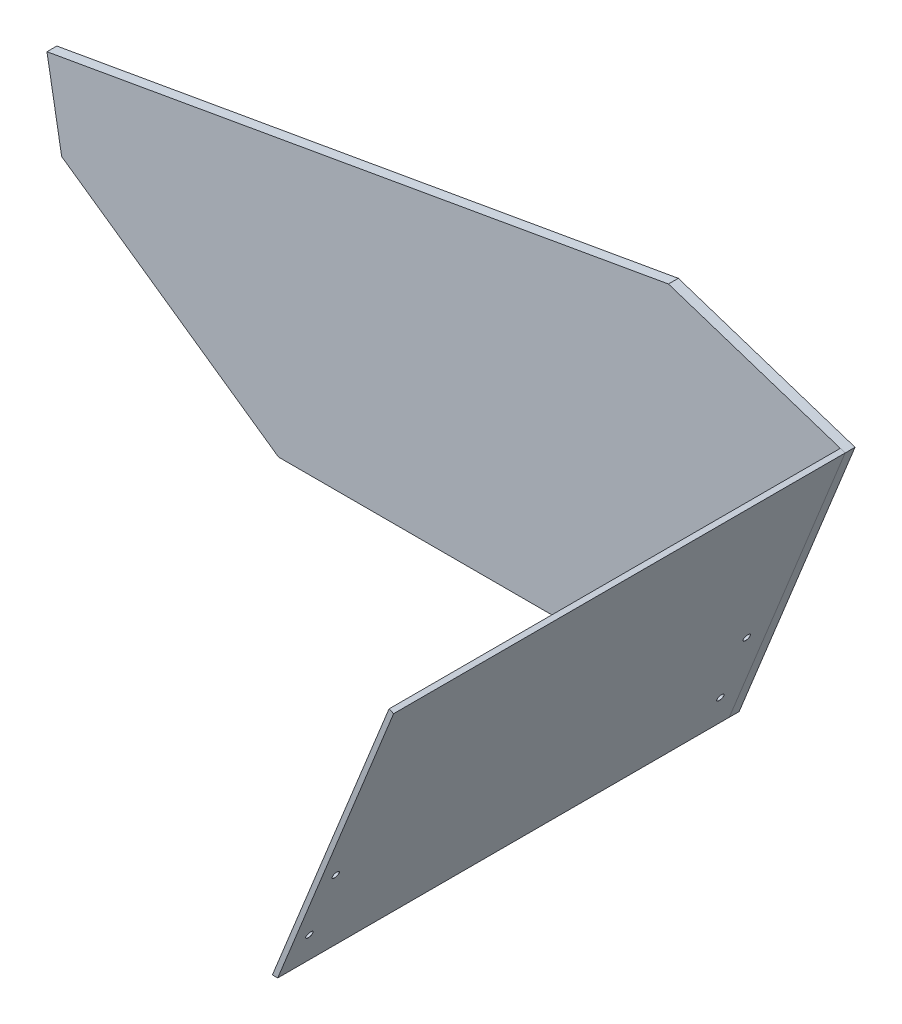
from build123d import *

# Parameters (mm, degrees)
BOSS_EXTRUDE1_DEPTH           = 290
BOSS_EXTRUDE2_DEPTH           = 6.35
M4_CLEARANCE_HOLE1_AT_2_COUNT = 2
M4_CLEARANCE_HOLE1_AT_2_PITCH = 45
M4_CLEARANCE_HOLE1_AT_3_COUNT = 2
M4_CLEARANCE_HOLE1_AT_3_PITCH = 264
M4_CLEARANCE_HOLE1_AT_4_COUNT = 2
M4_CLEARANCE_HOLE1_AT_4_PITCH = 267.807766878


with BuildPart() as part:
    # Sketch1 → Boss-Extrude1 (new body)
    with BuildSketch(Plane.XY):
        Polygon((140, 0), (143.424347808, 0), (217.865127421, 184.247394979), (214.921318683, 185.436770913), align=None)
    extrude(amount=BOSS_EXTRUDE1_DEPTH)

    # Sketch4 → M4 Clearance Hole1 (revolve, cut)
    with BuildSketch(Plane(origin=(169.646809347, 64.90286982, 279), x_dir=(0.3746065934159096, 0.9271838545667884, 0), z_dir=(0, 0, 1))):
        Polygon((0, 0), (0, 489.265093346), (2.25, 489.265093346), (2.25, 0.025), (2.275, 0), align=None)
    m4_clearance_hole1 = revolve(axis=Axis((175.534426824, 62.524117951, 279), (-0.9271838545667884, 0.37460659341590974, 0)), mode=Mode.SUBTRACT)

    # M4 Clearance Hole1 at 2: M4 Clearance Hole1 ×2
    with Locations(*[Vector(-0.3746065934159097, -0.9271838545667884, 0) * (i * M4_CLEARANCE_HOLE1_AT_2_PITCH) for i in range(1, M4_CLEARANCE_HOLE1_AT_2_COUNT)]):
        add(m4_clearance_hole1, mode=Mode.SUBTRACT)

    # M4 Clearance Hole1 at 3: M4 Clearance Hole1 ×2
    with Locations(*[(0, 0, -i * M4_CLEARANCE_HOLE1_AT_3_PITCH) for i in range(1, M4_CLEARANCE_HOLE1_AT_3_COUNT)]):
        add(m4_clearance_hole1, mode=Mode.SUBTRACT)

    # M4 Clearance Hole1 at 4: M4 Clearance Hole1 ×2
    with Locations(*[Vector(-0.0629455108798666, -0.15579560646033142, -0.9857817160344019) * (i * M4_CLEARANCE_HOLE1_AT_4_PITCH) for i in range(1, M4_CLEARANCE_HOLE1_AT_4_COUNT)]):
        add(m4_clearance_hole1, mode=Mode.SUBTRACT)


with BuildPart() as body_2:
    # Sketch2 → Boss-Extrude2 (new body)
    with BuildSketch(Plane.XY):
        Polygon((-294.777867348, 151.108031048), (104.369939009, 221.488558599), (217.865127421, 184.247394979), (143.424347808, 0), (-146.070887152, 0), (-285.326734681, 97.50799418), align=None)
    extrude(amount=-BOSS_EXTRUDE2_DEPTH)


solid = Compound([part.part, body_2.part])
